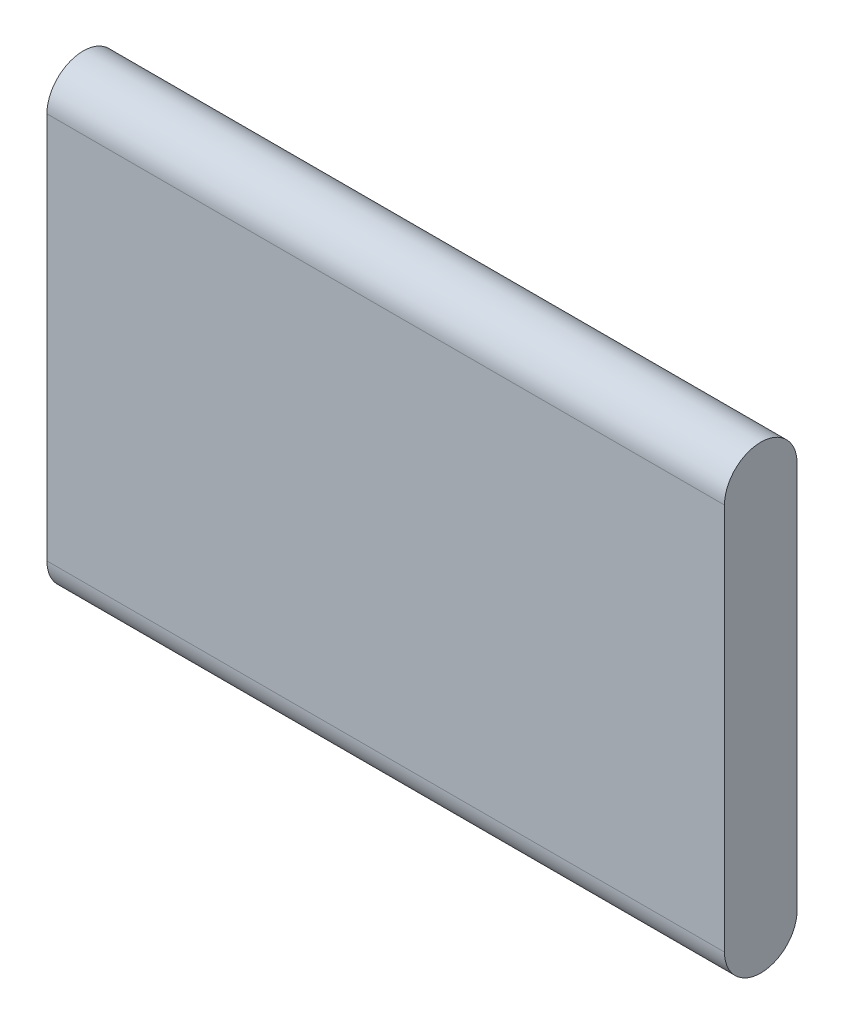
from build123d import *

# Parameters (mm, degrees)
BOSS_EXTRUDE1_DEPTH = 355.6


with BuildPart() as part:
    # Sketch1 → Boss-Extrude1 (new, symmetric)
    with BuildSketch(Plane(origin=(0, 0, 0), x_dir=(0, 0, -1), z_dir=(1, 0, 0))):
        with BuildLine():
            Line((-38.1, 203.2), (-38.1, -203.2))
            ThreePointArc((-38.1, -203.2), (0, -241.3), (38.1, -203.2))
            Line((38.1, -203.2), (38.1, 203.2))
            ThreePointArc((38.1, 203.2), (0, 241.3), (-38.1, 203.2))
        make_face()
    extrude(amount=BOSS_EXTRUDE1_DEPTH, both=True)


solid = part.part
